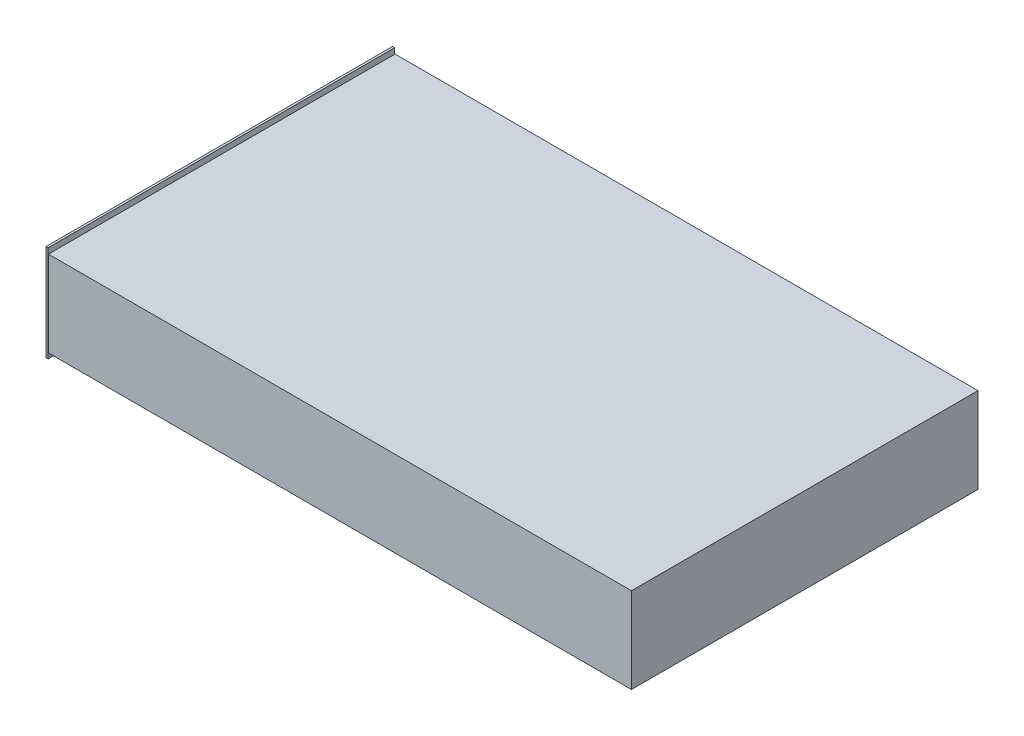
from build123d import *

# Parameters (mm, degrees)
EXTRUDE_1_OUTLINE_W     = 545
EXTRUDE_1_OUTLINE_H     = 324
EXTRUDE_1_DEPTH         = 1.5
EXTRUDE_START           = 78.5
EXTRUDE_1_2_OUTLINE_W   = 545
EXTRUDE_1_2_OUTLINE_H   = 324
EXTRUDE_1_2_DEPTH       = 1.5
EXTRUDE_START_2         = 1.5
EXTRUDE_1_3_OUTLINE_W   = 545
EXTRUDE_1_3_OUTLINE_H   = 324
EXTRUDE_1_3_OUTLINE_W_2 = 542
EXTRUDE_1_3_OUTLINE_H_2 = 321
EXTRUDE_1_3_DEPTH       = 77
SKETCH_2_W              = 2
SKETCH_2_H              = 90
EXTRUDE_2_DEPTH         = 162


# Read off the part's stored shape, not the designer's step: Вытянуть-Тонкостенный1
with BuildPart() as part:
    # Вытянуть-Тонкостенный1 outline → Вытянуть-Тонкостенный1 (new body)
    with BuildSketch(Plane(origin=(0, 0, 0), x_dir=(1, 0, 0), z_dir=(0, 1, 0))):
        with Locations((272.810788, 0)):
            Rectangle(EXTRUDE_1_OUTLINE_W, EXTRUDE_1_OUTLINE_H)
    extrude(amount=EXTRUDE_1_DEPTH)



with BuildPart() as body_2:
    # Extrude 1 2 outline → Extrude 1 2 (new body)
    with BuildSketch(Plane(origin=(0, 0, 0), x_dir=(1, 0, 0), z_dir=(0, 1, 0)).offset(EXTRUDE_START)):
        with Locations((272.810788, 0)):
            Rectangle(EXTRUDE_1_2_OUTLINE_W, EXTRUDE_1_2_OUTLINE_H)
    extrude(amount=EXTRUDE_1_2_DEPTH)


with BuildPart() as part_1:
    add(part.part)

    add(body_2.part)  # Extrude 1 3 merges body 2
    # Extrude 1 3 outline → Extrude 1 3 (add)
    with BuildSketch(Plane(origin=(0, 0, 0), x_dir=(1, 0, 0), z_dir=(0, 1, 0)).offset(EXTRUDE_START_2)):
        with Locations((272.810788, 0)):
            Rectangle(EXTRUDE_1_3_OUTLINE_W, EXTRUDE_1_3_OUTLINE_H)
        with Locations((272.810788, 0)):
            Rectangle(EXTRUDE_1_3_OUTLINE_W_2, EXTRUDE_1_3_OUTLINE_H_2, mode=Mode.SUBTRACT)
    extrude(amount=EXTRUDE_1_3_DEPTH)


with BuildPart() as body_2_2:
    # Эскиз2 → Вытянуть-Тонкостенный2 (new, symmetric)
    with BuildSketch(Plane.XY):
        with Locations((-1, 40)):
            Rectangle(SKETCH_2_W, SKETCH_2_H)
    extrude(amount=EXTRUDE_2_DEPTH, both=True)


solid = Compound([part_1.part, body_2_2.part])
